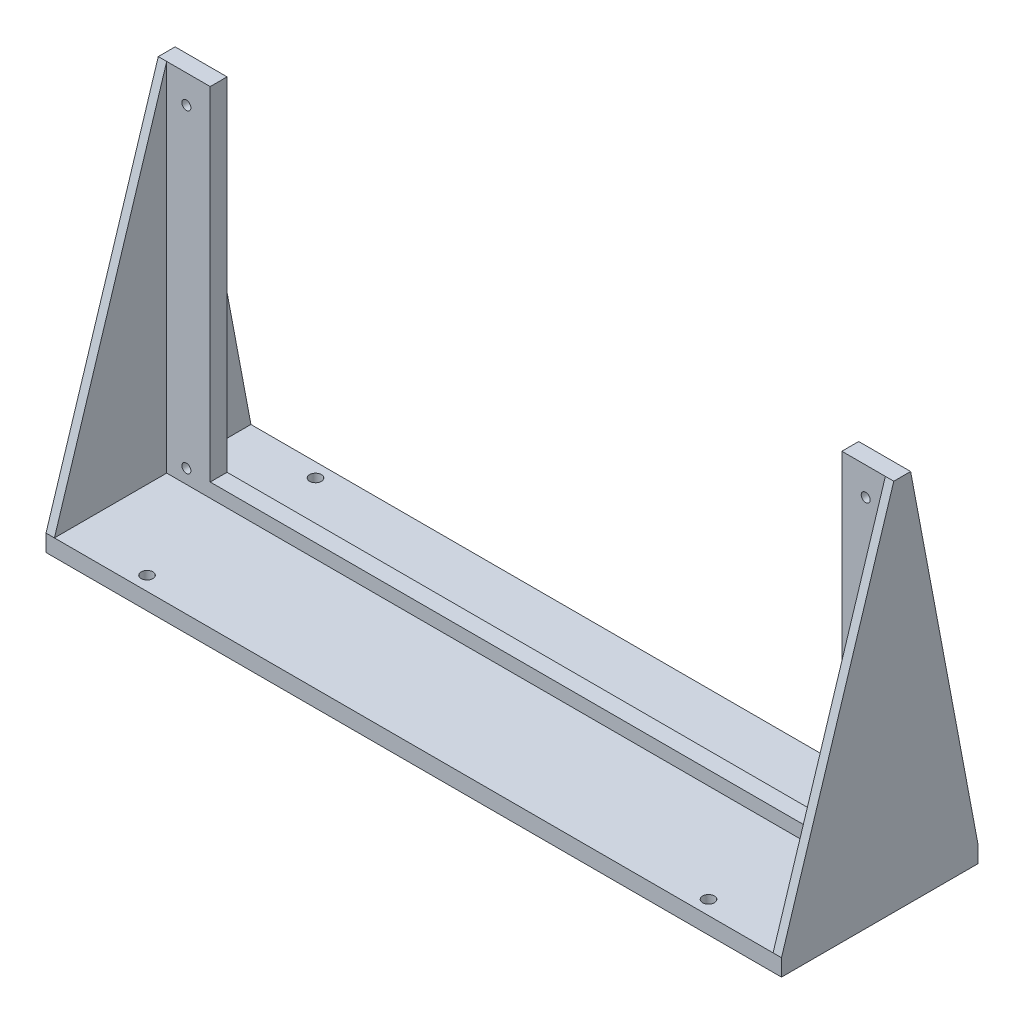
from build123d import *

# Parameters (mm, degrees)
SKETCH1_R           = 1.6
BOSS_EXTRUDE1_DEPTH = 6
SKETCH5_W           = 262
SKETCH5_H           = 6
BOSS_EXTRUDE3_DEPTH = 40
SKETCH5_2_W         = 262
SKETCH5_2_H         = 6
BOSS_EXTRUDE5_DEPTH = 30
SKETCH3_R           = 2.1
CUT_EXTRUDE1_DEPTH  = 189.164821367
SKETCH6_W           = 225
SKETCH6_H           = 122
CUT_EXTRUDE2_DEPTH  = 153.47950682
BOSS_EXTRUDE4_DEPTH = 3
BOSS_EXTRUDE6_DEPTH = 3


with BuildPart() as part:
    # Sketch1 → Boss-Extrude1 (new body)
    with BuildSketch(Plane.XY):
        Polygon((-131, -66), (-131, 66), (131, 66), (131, -66), (131, -67), (-131, -67), align=None)
        with Locations((-121, 56)):
            Circle(SKETCH1_R, mode=Mode.SUBTRACT)
        with Locations((121, 56)):
            Circle(SKETCH1_R, mode=Mode.SUBTRACT)
        with Locations((121, -56)):
            Circle(SKETCH1_R, mode=Mode.SUBTRACT)
        with Locations((-121, -56)):
            Circle(SKETCH1_R, mode=Mode.SUBTRACT)
    extrude(amount=BOSS_EXTRUDE1_DEPTH)

    # Sketch5 → Boss-Extrude3 (add)
    with BuildSketch(Plane.XY.offset(6)):
        with Locations((0, -64)):
            Rectangle(SKETCH5_W, SKETCH5_H)
    extrude(amount=BOSS_EXTRUDE3_DEPTH)

    # Sketch5<2> → Boss-Extrude5 (add)
    with BuildSketch(Plane.XY.offset(6)):
        with Locations((0, -64)):
            Rectangle(SKETCH5_2_W, SKETCH5_2_H)
    extrude(amount=-BOSS_EXTRUDE5_DEPTH)

    # Sketch3 → Cut-Extrude1 (cut, through all)
    with BuildSketch(Plane(origin=(0, -61, 0), x_dir=(1, 0, 0), z_dir=(0, 1, 0))):
        with Locations((-100, -41)):
            Circle(SKETCH3_R)
        with Locations((100, -41)):
            Circle(SKETCH3_R)
        with Locations((-100, 19)):
            Circle(SKETCH3_R)
        with Locations((100, 19)):
            Circle(SKETCH3_R)
    extrude(amount=-CUT_EXTRUDE1_DEPTH, mode=Mode.SUBTRACT)

    # Sketch6 → Cut-Extrude2 (cut, through all)
    with BuildSketch(Plane.XY.offset(6)):
        with Locations((0, 5)):
            Rectangle(SKETCH6_W, SKETCH6_H)
    extrude(amount=-CUT_EXTRUDE2_DEPTH, mode=Mode.SUBTRACT)

    # Sketch8 → Boss-Extrude4 (add)
    with BuildSketch(Plane(origin=(131, 0, 0), x_dir=(0, 0, -1), z_dir=(1, 0, 0))):
        Polygon((-6, 66), (-46, -61), (-6, -61), align=None)
        Polygon((0, 66), (0, -61), (24, -61), align=None)
    extrude(amount=-BOSS_EXTRUDE4_DEPTH)

    # Sketch7 → Boss-Extrude6 (add)
    with BuildSketch(Plane.ZY.offset(131)):
        Polygon((6, 66), (46, -61), (6, -61), align=None)
        Polygon((0, 66), (-24, -61), (0, -61), align=None)
    extrude(amount=-BOSS_EXTRUDE6_DEPTH)


solid = part.part
